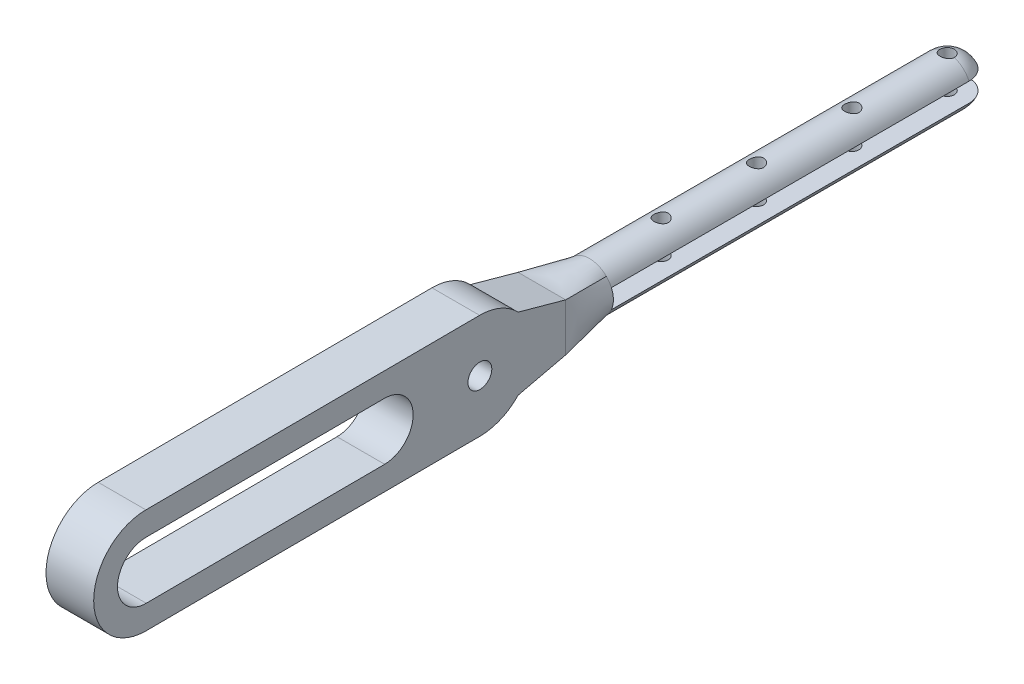
from build123d import *

# Parameters (mm, degrees)
SKETCH1_R               = 2.4999999999999947
BOSS_EXTRUDE1_DEPTH     = 10
CUT_EXTRUDE2_DEPTH      = 37.99999999999999
SKETCH8_R               = 4.999999999999999
BOSS_EXTRUDE2_DEPTH     = 79.99999999999999
FILLET1_R               = 5
CUT_EXTRUDE3_DEPTH      = 89.99999999999999
CUT_EXTRUDE4_DEPTH      = 154.3205877044287
CUT_EXTRUDE4_DEPTH_BACK = 154.3205877044287
SKETCH10_R              = 1.5
SKETCH10_R_2            = 1.5000000000000018


with BuildPart() as part:
    # Sketch1 → Boss-Extrude1 (new body)
    with BuildSketch(Plane(origin=(0, 0, 0), x_dir=(0, 0, -1), z_dir=(1, 0, 0))):
        with BuildLine():
            Line((-25.052380358502706, 10.880827666520085), (44.9476196414973, 11.214160999853437))
            ThreePointArc((44.9476196414973, 11.214160999853437), (55.9998752855677, 0.2666660727884313), (45.0523803585027, -10.785589571281967))
            Line((45.0523803585027, -10.785589571281967), (-24.947619641497294, -11.118922904615314))
            ThreePointArc((-24.947619641497294, -11.118922904615314), (-35.99987528556771, -0.1714279775503225), (-25.052380358502706, 10.880827666520085))
        make_face()
        with Locations((45, 0.21428571428572923)):
            Circle(SKETCH1_R, mode=Mode.SUBTRACT)
        with BuildLine():
            Line((-25.028571104637827, 5.8808843548984004), (24.971428895362127, 6.118979592993658))
            ThreePointArc((24.971428895362127, 6.118979592993658), (30.999931973946005, 0.14761872368547516), (25.028571104637816, -5.880884354898377))
            Line((25.028571104637816, -5.880884354898377), (-24.971428895362145, -6.118979592993635))
            ThreePointArc((-24.971428895362145, -6.118979592993635), (-30.99993197394602, -0.14761872368546008), (-25.028571104637827, 5.8808843548984004))
        make_face(mode=Mode.SUBTRACT)
    extrude(amount=BOSS_EXTRUDE1_DEPTH)

    # Sketch3 → Cut-Extrude2 (cut)
    with BuildSketch(Plane(origin=(0, 0, 0), x_dir=(0, 0, -1), z_dir=(1, 0, 0))):
        Polygon((53, 10.001615179604634), (63.49944185012656, 10.001615179604633), (63.49944185012656, -12.997162206386868), (53, -12.997162206386866), align=None)
    extrude(amount=CUT_EXTRUDE2_DEPTH, mode=Mode.SUBTRACT)

    # Sketch5 → section 0 of loft1
    with BuildSketch(Plane(origin=(0, 0, -63), x_dir=(-1, 0, 0), z_dir=(0, 0, -1)), mode=Mode.PRIVATE) as loft1_s0:
        with BuildLine():
            Line((-9.999999999999998, 5), (0, 5))
            Line((0, 5), (0, -5))
            Line((0, -5), (-9.999999999999998, -5))
            Line((-9.999999999999998, -5), (-9.999999999999998, 5))
        make_face()
    # loft up to a face of the part (loft1)
    loft([loft1_s0.sketch, part.faces().sort_by_distance((5, 0.21428571428573592, -53))[0]])

    # Loft3: read off the stored shape, not the designer's step
    # Loft3: loft between two sections, ruled curve by curve
    loft3_from = [
        Edge.make_bspline([(1.464466094, 3.535533906, -73), (1.047799427, 3.118867239, -73), (0.674207019, 2.593397212, -73), (0.279832406, 1.6821315, -73), (0.176075175, 1.358816515, -73), (0.036115533, 0.690278229, -73), (0, 0.345177969, -73), (0, -0.345177969, -73), (0.036115533, -0.690278229, -73), (0.176075175, -1.358816515, -73), (0.279832406, -1.6821315, -73), (0.674207019, -2.593397212, -73), (1.047799427, -3.118867239, -73), (1.464466094, -3.535533906, -73)], [0, 0, 0, 0, 0.25, 0.25, 0.375, 0.375, 0.5, 0.5, 0.625, 0.625, 0.75, 0.75, 1, 1, 1, 1], 3),
        Edge.make_bspline([(1.464466094, -3.535533906, -73), (1.881132761, -3.952200573, -73), (2.406602788, -4.325792981, -73), (3.3178685, -4.720167594, -73), (3.641183485, -4.823924825, -73), (4.309721771, -4.963884467, -73), (4.654822031, -5, -73), (5.345177969, -5, -73), (5.690278229, -4.963884467, -73), (6.358816515, -4.823924825, -73), (6.6821315, -4.720167594, -73), (7.593397212, -4.325792981, -73), (8.118867239, -3.952200573, -73), (8.535533906, -3.535533906, -73)], [0, 0, 0, 0, 0.25, 0.25, 0.375, 0.375, 0.5, 0.5, 0.625, 0.625, 0.75, 0.75, 1, 1, 1, 1], 3),
        Edge.make_bspline([(8.535533906, 3.535533906, -73), (8.118867239, 3.952200573, -73), (7.593397212, 4.325792981, -73), (6.6821315, 4.720167594, -73), (6.358816515, 4.823924825, -73), (5.690278229, 4.963884467, -73), (5.345177969, 5, -73), (4.654822031, 5, -73), (4.309721771, 4.963884467, -73), (3.641183485, 4.823924825, -73), (3.3178685, 4.720167594, -73), (2.406602788, 4.325792981, -73), (1.881132761, 3.952200573, -73), (1.464466094, 3.535533906, -73)], [0, 0, 0, 0, 0.25, 0.25, 0.375, 0.375, 0.5, 0.5, 0.625, 0.625, 0.75, 0.75, 1, 1, 1, 1], 3),
        Edge.make_bspline([(8.535533906, -3.535533906, -73), (8.952200573, -3.118867239, -73), (9.325792981, -2.593397212, -73), (9.720167594, -1.6821315, -73), (9.823924825, -1.358816515, -73), (9.963884467, -0.690278229, -73), (10, -0.345177969, -73), (10, 0.345177969, -73), (9.963884467, 0.690278229, -73), (9.823924825, 1.358816515, -73), (9.720167594, 1.6821315, -73), (9.325792981, 2.593397212, -73), (8.952200573, 3.118867239, -73), (8.535533906, 3.535533906, -73)], [0, 0, 0, 0, 0.25, 0.25, 0.375, 0.375, 0.5, 0.5, 0.625, 0.625, 0.75, 0.75, 1, 1, 1, 1], 3),
    ]
    loft3_to = [
        Edge.make_bspline([(0, 5, -63), (0, 4.166666667, -63), (0, 3.333333333, -63), (0, 2.083333333, -63), (0, 1.666666667, -63), (0, 0.833333333, -63), (0, 0.416666667, -63), (0, -0.416666667, -63), (0, -0.833333333, -63), (0, -1.666666667, -63), (0, -2.083333333, -63), (0, -3.333333333, -63), (0, -4.166666667, -63), (0, -5, -63)], [0, 0, 0, 0, 0.25, 0.25, 0.375, 0.375, 0.5, 0.5, 0.625, 0.625, 0.75, 0.75, 1, 1, 1, 1], 3),
        Edge.make_bspline([(0, -5, -63), (0.833333333, -5, -63), (1.666666667, -5, -63), (2.916666667, -5, -63), (3.333333333, -5, -63), (4.166666667, -5, -63), (4.583333333, -5, -63), (5.416666667, -5, -63), (5.833333333, -5, -63), (6.666666667, -5, -63), (7.083333333, -5, -63), (8.333333333, -5, -63), (9.166666667, -5, -63), (10, -5, -63)], [0, 0, 0, 0, 0.25, 0.25, 0.375, 0.375, 0.5, 0.5, 0.625, 0.625, 0.75, 0.75, 1, 1, 1, 1], 3),
        Edge.make_bspline([(10, 5, -63), (9.166666667, 5, -63), (8.333333333, 5, -63), (7.083333333, 5, -63), (6.666666667, 5, -63), (5.833333333, 5, -63), (5.416666667, 5, -63), (4.583333333, 5, -63), (4.166666667, 5, -63), (3.333333333, 5, -63), (2.916666667, 5, -63), (1.666666667, 5, -63), (0.833333333, 5, -63), (0, 5, -63)], [0, 0, 0, 0, 0.25, 0.25, 0.375, 0.375, 0.5, 0.5, 0.625, 0.625, 0.75, 0.75, 1, 1, 1, 1], 3),
        Edge.make_bspline([(10, -5, -63), (10, -4.166666667, -63), (10, -3.333333333, -63), (10, -2.083333333, -63), (10, -1.666666667, -63), (10, -0.833333333, -63), (10, -0.416666667, -63), (10, 0.416666667, -63), (10, 0.833333333, -63), (10, 1.666666667, -63), (10, 2.083333333, -63), (10, 3.333333333, -63), (10, 4.166666667, -63), (10, 5, -63)], [0, 0, 0, 0, 0.25, 0.25, 0.375, 0.375, 0.5, 0.5, 0.625, 0.625, 0.75, 0.75, 1, 1, 1, 1], 3),
    ]
    loft3 = Solid(Shell([*[Face.make_surface_from_curves(loft3_from[k], loft3_to[k]) for k in range(4)], Face(Wire(loft3_from)), Face(Wire(loft3_to))]))
    add(loft3)

    # Sketch8 → Boss-Extrude2 (add)
    with BuildSketch(Plane(origin=(0, 0, -73), x_dir=(-1, 0, 0), z_dir=(0, 0, -1))):
        with Locations(Location((-4.999999999999999, 0, 0), (0, 0, 135))):
            Circle(SKETCH8_R)
    extrude(amount=BOSS_EXTRUDE2_DEPTH)

    # Fillet1
    fillet1_edges = [part.edges().sort_by_distance(p)[0] for p in [
        (1.4644660940672627, -3.5355339059327378, -153),
    ]]
    fillet(fillet1_edges, radius=FILLET1_R)

    # Sketch9 → Cut-Extrude3 (cut)
    with BuildSketch(Plane(origin=(0, 0, -73), x_dir=(-1, 0, 0), z_dir=(0, 0, -1))):
        Polygon((-10, 1.999999999999994), (-7.2e-16, 2), (5e-16, -2), (-9.999999999999998, -2), align=None)
    extrude(amount=CUT_EXTRUDE3_DEPTH, mode=Mode.SUBTRACT)

    # Sketch10 → Cut-Extrude4 (cut, two sides: drawn at the far end of the back side and taken through both)
    with BuildSketch(Plane(origin=(0, 0, 0), x_dir=(1, 0, 0), z_dir=(0, 1, 0)).offset(-CUT_EXTRUDE4_DEPTH_BACK)):
        with Locations((4.999999999999999, 147.99999999999997)):
            Circle(SKETCH10_R)
        with Locations(Location((5.000000000000005, 127.99999999999997, 0), (0, 0, 90))):
            Circle(SKETCH10_R_2)
        with Locations(Location((5.000000000000004, 107.99999999999997, 0), (0, 0, 90))):
            Circle(SKETCH10_R_2)
        with Locations(Location((5.000000000000007, 87.99999999999997, 0), (0, 0, 90))):
            Circle(SKETCH10_R_2)
    extrude(amount=CUT_EXTRUDE4_DEPTH + CUT_EXTRUDE4_DEPTH_BACK, mode=Mode.SUBTRACT)


solid = part.part
